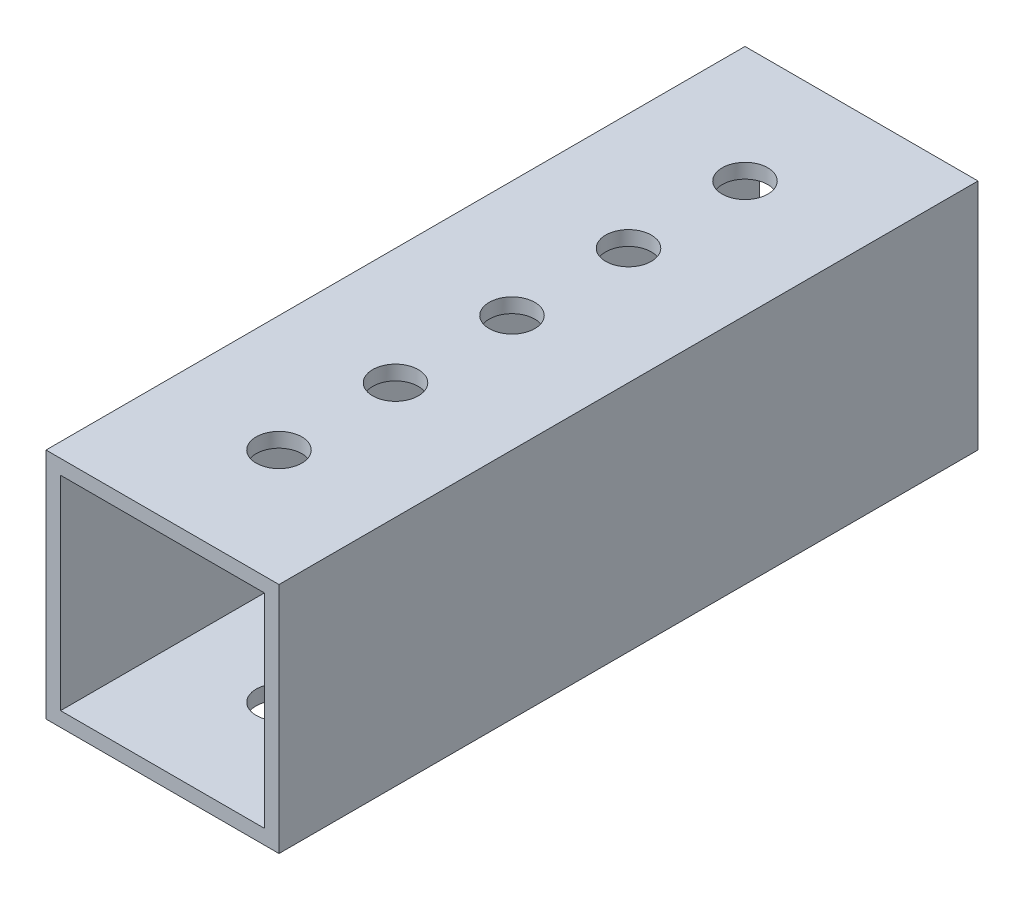
from build123d import *

# Parameters (mm, degrees)
SKETCH1_W               = 25.4
SKETCH1_H               = 25.4
BOSS_EXTRUDE1_DEPTH     = 38.1
SHELL1_T                = -1.5875
CUT_EXTRUDE1_DEPTH      = 43.121134838
CUT_EXTRUDE1_DEPTH_BACK = 43.121134838
SKETCH2_R               = 2.4892


with BuildPart() as part:
    # Sketch1 → Boss-Extrude1 (new, symmetric)
    with BuildSketch(Plane.XY):
        Rectangle(SKETCH1_W, SKETCH1_H)
    extrude(amount=BOSS_EXTRUDE1_DEPTH, both=True)

    # Shell1
    shell1_openings = [part.faces().sort_by_distance(p)[0] for p in [
        (0, 0, -38.1),
        (0, 0, 38.1),
    ]]
    offset(amount=SHELL1_T, openings=shell1_openings, kind=Kind.INTERSECTION)

    # Sketch2 → Cut-Extrude1 (cut, two sides: drawn at the far end of the back side and taken through both)
    with BuildSketch(Plane(origin=(0, 0, 0), x_dir=(1, 0, 0), z_dir=(0, 1, 0)).offset(-CUT_EXTRUDE1_DEPTH_BACK)):
        with Locations((0, -25.4)):
            Circle(SKETCH2_R)
        with Locations((0, -12.7)):
            Circle(SKETCH2_R)
        Circle(SKETCH2_R)
        with Locations((0, 12.7)):
            Circle(SKETCH2_R)
        with Locations((0, 25.4)):
            Circle(SKETCH2_R)
    extrude(amount=CUT_EXTRUDE1_DEPTH + CUT_EXTRUDE1_DEPTH_BACK, mode=Mode.SUBTRACT)


solid = part.part
